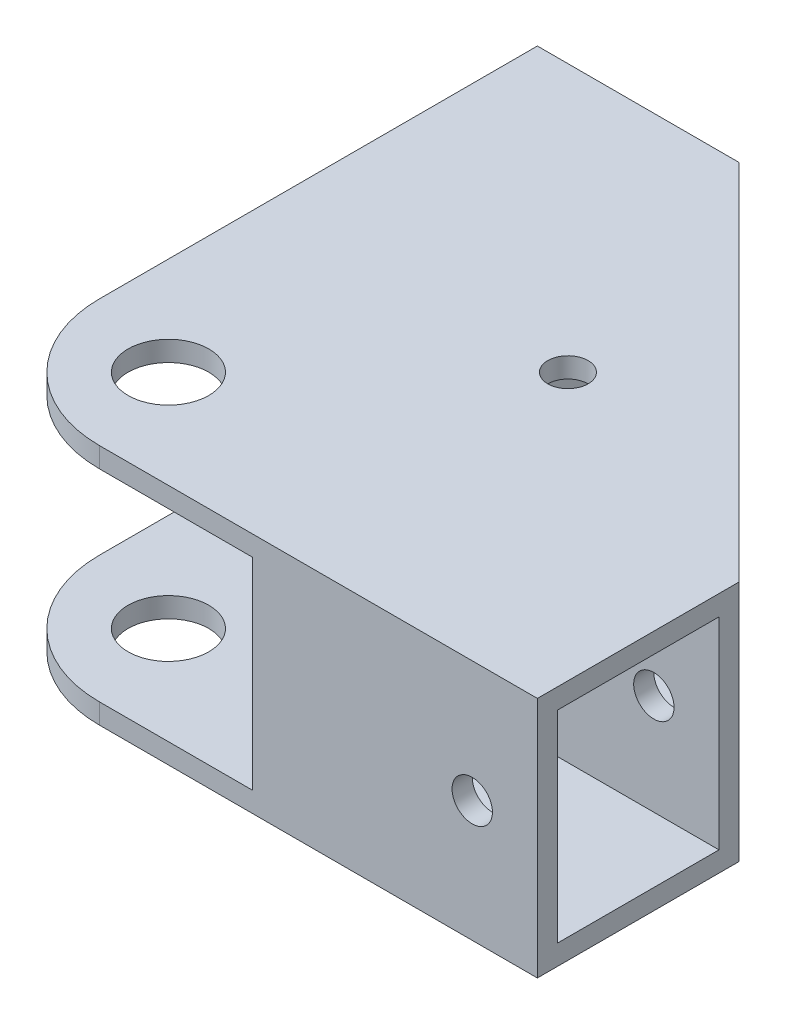
from build123d import *

# Parameters (mm, degrees)
BOSS_EXTRUDE1_DEPTH     = 38.1
SKETCH2_W               = 25.4
SKETCH2_H               = 31.75
CUT_EXTRUDE1_DEPTH      = 88.9
CUT_EXTRUDE2_REACH      = 133.37
SKETCH3_W               = 25.4
SKETCH3_H               = 31.75
CUT_EXTRUDE3_START      = -62.861793
SKETCH4_W               = 75
SKETCH4_H               = 31.75
CUT_EXTRUDE3_DEPTH      = 28.575
FILLET4_R               = 20
CUT_EXTRUDE8_DEPTH      = 131.484388453
CUT_EXTRUDE8_DEPTH_BACK = 131.484388453
SKETCH8_R               = 6.35
BOSS_EXTRUDE2_DEPTH     = 3.175
CUT_EXTRUDE10_REACH     = 133.37
SKETCH35_R              = 3.175
CUT_EXTRUDE11_REACH     = 133.37
SKETCH36_R              = 3.175
FILLET8_R               = 5
CHAMFER1_SIZE           = 10
CHAMFER1_SIZE_2         = 7.071067812
CUT_EXTRUDE12_REACH     = 133.37
SKETCH37_R              = 3.175


with BuildPart() as part:
    # Sketch1 → Boss-Extrude1 (new body)
    with BuildSketch(Plane(origin=(0, 0, 0), x_dir=(1, 0, 0), z_dir=(0, 1, 0))):
        Polygon((0, 0), (-88.9, 0), (-88.9, 88.9), (-57.15, 88.9), (-57.15, 31.75), (0, 31.75), align=None)
    extrude(amount=BOSS_EXTRUDE1_DEPTH)

    # Sketch2 → Cut-Extrude1 (cut)
    with BuildSketch(Plane(origin=(0, 0, 0), x_dir=(0, 0, -1), z_dir=(1, 0, 0))):
        with Locations((15.875, 19.05)):
            Rectangle(SKETCH2_W, SKETCH2_H)
    extrude(amount=-CUT_EXTRUDE1_DEPTH, mode=Mode.SUBTRACT)

    # Cut-Extrude2: up to this face of the body (flat: up to its plane)
    cut_extrude2_end = Plane(part.part.faces().sort_by_distance((-44.45, 19.05, 0))[0])
    # Sketch3 → Cut-Extrude2 (cut, up to the picked face)
    with BuildSketch(Plane(origin=(0, 0, -88.9), x_dir=(-1, 0, 0), z_dir=(0, 0, -1)), mode=Mode.PRIVATE) as cut_extrude2_sk1:
        with Locations((73.025, 19.05)):
            Rectangle(SKETCH3_W, SKETCH3_H)
    cut_extrude2_tool1 = split(extrude(cut_extrude2_sk1.sketch, amount=-CUT_EXTRUDE2_REACH, mode=Mode.PRIVATE), bisect_by=cut_extrude2_end, keep=Keep.BOTH, mode=Mode.PRIVATE)
    add(cut_extrude2_tool1.solids().sort_by(Axis((-73.025, 19.05, -88.9), (0, 0, 1)))[0], mode=Mode.SUBTRACT)

    # Sketch4 → Cut-Extrude3 (cut)
    with BuildSketch(Plane(origin=(0, 0, 0), x_dir=(-0.7071067811865475, 0, -0.7071067811865476), z_dir=(0.7071067811865476, 0, -0.7071067811865475)).offset(CUT_EXTRUDE3_START)):
        with Locations((62.861792847, 19.05)):
            Rectangle(SKETCH4_W, SKETCH4_H)
    extrude(amount=CUT_EXTRUDE3_DEPTH, mode=Mode.SUBTRACT)

    # Fillet4
    fillet4_edges = [part.edges().sort_by_distance(p)[0] for p in [
        (-88.9, 36.5125, 0),
        (-88.9, 1.5875, 0),
    ]]
    fillet(fillet4_edges, radius=FILLET4_R)

    # Sketch8 → Cut-Extrude8 (cut, two sides: drawn at the far end of the back side and taken through both)
    with BuildSketch(Plane.XZ.offset(-34.925).offset(-CUT_EXTRUDE8_DEPTH_BACK)):
        with Locations(Location((-73.476280605, -15.423719395, 0), (0, 0, 270))):
            Circle(SKETCH8_R)
    extrude(amount=CUT_EXTRUDE8_DEPTH + CUT_EXTRUDE8_DEPTH_BACK, mode=Mode.SUBTRACT)

    # Sketch29 → Boss-Extrude2 (add)
    with BuildSketch(Plane(origin=(0, 38.1, 0), x_dir=(1, 0, 0), z_dir=(0, 1, 0))):
        Polygon((-57.15, 88.9), (0, 31.75), (-57.15, 31.75), align=None)
    boss_extrude2 = extrude(amount=-BOSS_EXTRUDE2_DEPTH)

    # Cut-Extrude10: up to this face of the body (flat: up to its plane)
    cut_extrude10_end = Plane(part.part.faces().sort_by_distance((-57.15, 17.4625, -60.325))[0])
    # Sketch35 → Cut-Extrude10 (cut, up to the picked face)
    with BuildSketch(Plane.ZY.offset(88.9), mode=Mode.PRIVATE) as cut_extrude10_sk1:
        with Locations((-78.65, 19.05)):
            Circle(SKETCH35_R)
    cut_extrude10_tool1 = split(extrude(cut_extrude10_sk1.sketch, amount=-CUT_EXTRUDE10_REACH, mode=Mode.PRIVATE), bisect_by=cut_extrude10_end, keep=Keep.BOTH, mode=Mode.PRIVATE)
    add(cut_extrude10_tool1.solids().sort_by(Axis((-88.9, 19.05, -78.65), (1, 0, 0)))[0], mode=Mode.SUBTRACT)

    # Cut-Extrude11: up to this face of the body (flat: up to its plane)
    cut_extrude11_end = Plane(part.part.faces().sort_by_distance((-28.575, 17.4625, -31.75))[0])
    # Sketch36 → Cut-Extrude11 (cut, up to the picked face)
    with BuildSketch(Plane.XY, mode=Mode.PRIVATE) as cut_extrude11_sk1:
        with Locations((-10.25, 19.05)):
            Circle(SKETCH36_R)
    cut_extrude11_tool1 = split(extrude(cut_extrude11_sk1.sketch, amount=-CUT_EXTRUDE11_REACH, mode=Mode.PRIVATE), bisect_by=cut_extrude11_end, keep=Keep.BOTH, mode=Mode.PRIVATE)
    add(cut_extrude11_tool1.solids().sort_by(Axis((-10.25, 19.05, 0), (0, 0, -1)))[0], mode=Mode.SUBTRACT)

    # Mirror1: Boss-Extrude2 across plane
    add(boss_extrude2.mirror(Plane(origin=(0, 19.05, 0), x_dir=(0, 0, 1), z_dir=(0, -1, 0))))

    # Fillet8
    fillet8_edges = [part.edges().sort_by_distance(p)[0] for p in [
        (-57.15, 19.05, -31.75),
        (-60.325, 19.05, -28.575),
    ]]
    fillet(fillet8_edges, radius=FILLET8_R)

    # Chamfer1
    # the kernel refuses this chamfer: 10, 7.071067812 mm, written as the material it takes off along each edge
    with BuildSketch(Plane(origin=(-51.663847671, 3.175, -3.175), x_dir=(0.9996219169112968, 0, -0.027495876610586317), z_dir=(0, 1, 0)), Plane(origin=(-85.725, 34.925, -37.236152329), x_dir=(0.027495876610586317, 0, -0.9996219169112968), z_dir=(0, -1, 0))) as chamfer1_piece_1:
        Polygon((CHAMFER1_SIZE * 0.999621916911, -CHAMFER1_SIZE * 0.0274958766106), (CHAMFER1_SIZE_2 * 0.687396915252, -CHAMFER1_SIZE_2 * 0.726281956863), (0, 0), align=None)
    extrude(amount=31.75, mode=Mode.SUBTRACT)

    # Cut-Extrude12: up to this face of the body (flat: up to its plane)
    cut_extrude12_end = Plane(part.part.faces().sort_by_distance((-50.123943702, 38.1, -38.776056298))[0])
    # Sketch37 → Cut-Extrude12 (cut, up to the picked face)
    with BuildSketch(Plane.XZ, mode=Mode.PRIVATE) as cut_extrude12_sk1:
        with Locations(Location((-42.045384182, -46.854615818, 0), (0, 0, 270))):
            Circle(SKETCH37_R)
    cut_extrude12_tool1 = split(extrude(cut_extrude12_sk1.sketch, amount=-CUT_EXTRUDE12_REACH, mode=Mode.PRIVATE), bisect_by=cut_extrude12_end, keep=Keep.BOTH, mode=Mode.PRIVATE)
    add(cut_extrude12_tool1.solids().sort_by(Axis((-42.045384, 0, -46.854616), (0, 1, 0)))[0], mode=Mode.SUBTRACT)


solid = part.part
